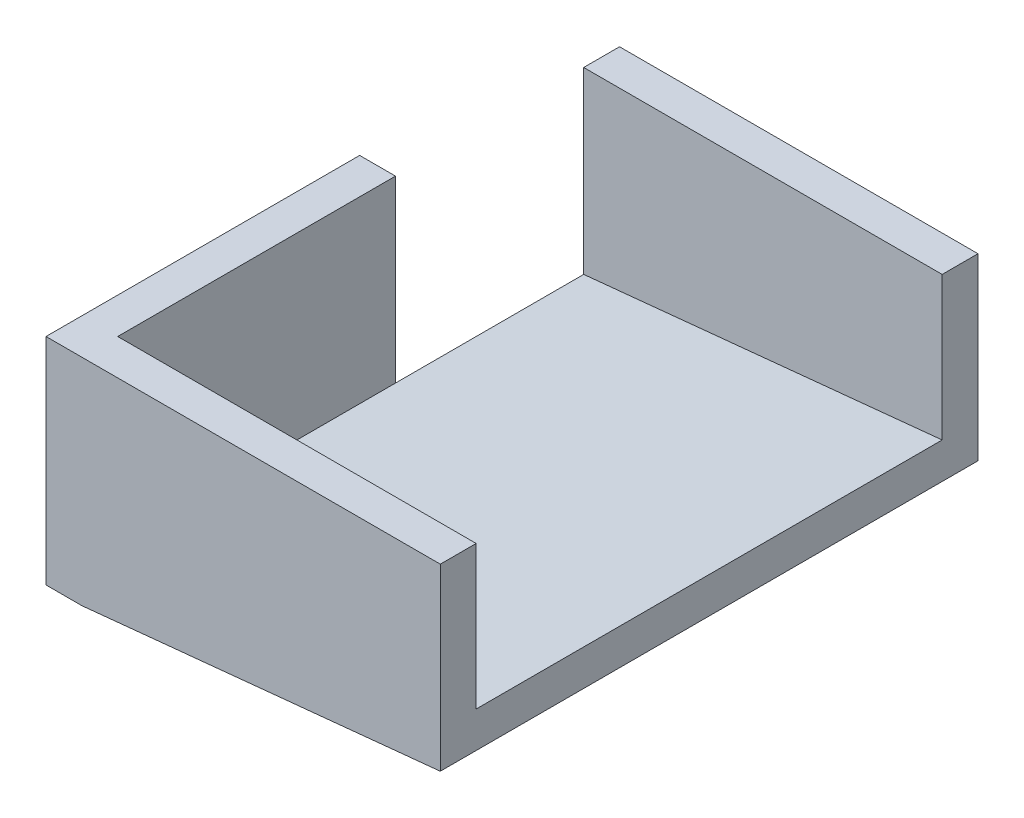
from build123d import *

# Parameters (mm, degrees)
BOSS_EXTRUDE1_DEPTH     = 300
SKETCH3_W               = 200
SKETCH3_H               = 20
BOSS_EXTRUDE3_DEPTH     = 90
CUT_EXTRUDE1_DEPTH      = 311.64449134
CUT_EXTRUDE1_DEPTH_BACK = 311.64449134
SKETCH5_W               = 200.997512422
SKETCH5_H               = 300
BOSS_EXTRUDE4_DEPTH     = 13.35
BOSS_EXTRUDE5_DEPTH     = 300
CUT_EXTRUDE2_START      = 100
CUT_EXTRUDE2_OUTLINE_W  = 16
CUT_EXTRUDE2_OUTLINE_H  = 302
CUT_EXTRUDE2_DEPTH      = 2
BOSS_EXTRUDE6_DEPTH     = 20
SKETCH9_W               = 20
SKETCH9_H               = 150
BOSS_EXTRUDE7_DEPTH     = 100
SKETCH10_W              = 20
SKETCH10_H              = 120.070032415
BOSS_EXTRUDE8_DEPTH     = 5


with BuildPart() as part:
    # Sketch2 → Boss-Extrude1 (new body)
    with BuildSketch(Plane.XY):
        Polygon((-100, -10), (-100, -16.653448461), (100, 3.346551539), (100, 10), align=None)
    extrude(amount=BOSS_EXTRUDE1_DEPTH)

    # Sketch3 → Boss-Extrude3 (add, symmetric)
    with BuildSketch(Plane(origin=(0, 0, 0), x_dir=(1, 0, 0), z_dir=(0, 1, 0))):
        with Locations((0, -10)):
            Rectangle(SKETCH3_W, SKETCH3_H)
        with Locations((0, -290)):
            Rectangle(SKETCH3_W, SKETCH3_H)
    extrude(amount=BOSS_EXTRUDE3_DEPTH, both=True)

    # Sketch4 → Cut-Extrude1 (cut, two sides: drawn at the far end of the back side and taken through both)
    with BuildSketch(Plane.XY.offset(20).offset(-CUT_EXTRUDE1_DEPTH_BACK)):
        Polygon((-100, -16.653448461), (-100, -90), (100, -90), (100, 3.346551539), align=None)
    extrude(amount=CUT_EXTRUDE1_DEPTH + CUT_EXTRUDE1_DEPTH_BACK, mode=Mode.SUBTRACT)

    # Sketch5 → Boss-Extrude4 (add)
    with BuildSketch(Plane(origin=(0.658757273, -6.587572734, 0), x_dir=(0.9950371902099892, 0.09950371902099911, 0), z_dir=(0.09950371902099912, -0.9950371902099893, 0))):
        with Locations((-0.662042866, 150)):
            Rectangle(SKETCH5_W, SKETCH5_H)
    extrude(amount=BOSS_EXTRUDE4_DEPTH)

    # Boss-Extrude5: read off the stored shape, not the designer's step
    # Boss-Extrude5 outline → Boss-Extrude5 (add)
    with BuildSketch(Plane.XY):
        Polygon((-100, -16.653448461), (-100, -30.070032415), (-98.671625351, -29.93719495), align=None)
    extrude(amount=BOSS_EXTRUDE5_DEPTH)

    # Cut-Extrude2: read off the stored shape, not the designer's step
    # Cut-Extrude2 outline → Cut-Extrude2 (cut)
    with BuildSketch(Plane.YZ.offset(CUT_EXTRUDE2_START)):
        with Locations((-3, 150)):
            Rectangle(CUT_EXTRUDE2_OUTLINE_W, CUT_EXTRUDE2_OUTLINE_H)
    extrude(amount=CUT_EXTRUDE2_DEPTH, mode=Mode.SUBTRACT)

    # Sketch8 → Boss-Extrude6 (add)
    with BuildSketch(Plane.ZY.offset(100)):
        Polygon((300, 90), (280, 90), (280, -10), (130, -10), (130, -30.070032415), (300, -30.070032415), align=None)
    extrude(amount=BOSS_EXTRUDE6_DEPTH)

    # Sketch9 → Boss-Extrude7 (add)
    with BuildSketch(Plane(origin=(0, -10, 0), x_dir=(1, 0, 0), z_dir=(0, 1, 0))):
        with Locations((-110, -205)):
            Rectangle(SKETCH9_W, SKETCH9_H)
    extrude(amount=BOSS_EXTRUDE7_DEPTH)

    # Sketch10 → Boss-Extrude8 (add)
    with BuildSketch(Plane(origin=(0, 0, 130), x_dir=(-1, 0, 0), z_dir=(0, 0, -1))):
        with Locations((110, 29.964983792)):
            Rectangle(SKETCH10_W, SKETCH10_H)
    extrude(amount=BOSS_EXTRUDE8_DEPTH)


solid = part.part
